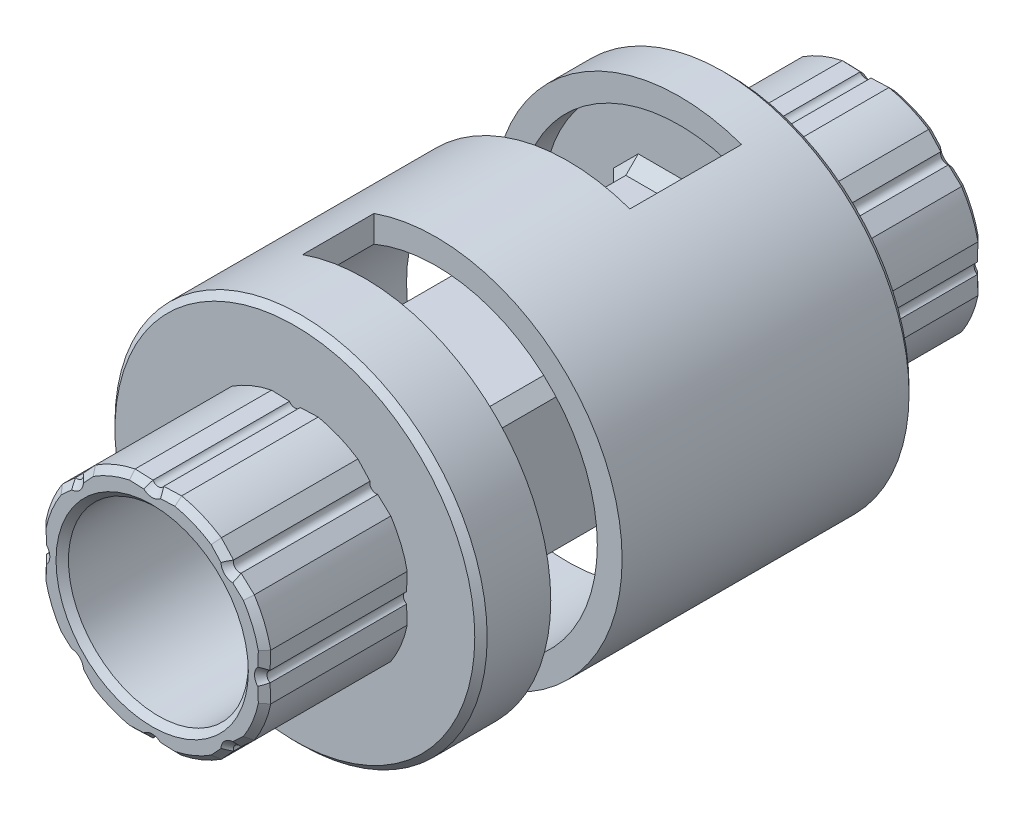
from build123d import *
from OCP.BRepFilletAPI import BRepFilletAPI_MakeChamfer

# Parameters (mm, degrees)
SKETCH1_R               = 30
SKETCH1_R_2             = 26
BOSS_EXTRUDE1_DEPTH     = 70
CUT_EXTRUDE1_DEPTH      = 82.8535277187245
CUT_EXTRUDE1_DEPTH_BACK = 82.8535277187245
SKETCH2_W               = 40
SKETCH2_H               = 17.999999999999996
BOSS_EXTRUDE2_START     = -4
SKETCH4_R               = 30
BOSS_EXTRUDE2_DEPTH     = 4
SKETCH5_R               = 30
BOSS_EXTRUDE3_DEPTH     = 4
SKETCH8_R               = 18.5
SKETCH8_R_2             = 14.499999999999998
BOSS_EXTRUDE4_DEPTH     = 20
BOSS_EXTRUDE5_START     = 20
SKETCH9_R               = 18.5
SKETCH9_R_2             = 14.499999999999998
BOSS_EXTRUDE5_DEPTH     = 20
SKETCH13_R              = 1.0000000000000002
SKETCH13_R_2            = 1.00000000000011
SKETCH13_R_3            = 1.000000000000757
SKETCH13_R_4            = 1.0000000000015887
SKETCH13_R_5            = 1.0000000000021285
SKETCH13_R_6            = 1.0000000000020766
SKETCH13_R_7            = 1.0000000000014964
SKETCH13_R_8            = 1.0000000000007303
CUT_EXTRUDE4_DEPTH      = 20
CUT_EXTRUDE5_START      = -20
SKETCH14_R              = 1.0000000000000007
SKETCH14_R_2            = 1.0000000000000917
SKETCH14_R_3            = 1.000000000000583
SKETCH14_R_4            = 1.000000000001215
SKETCH14_R_5            = 1.0000000000016258
SKETCH14_R_6            = 1.0000000000015943
SKETCH14_R_7            = 1.0000000000011684
SKETCH14_R_8            = 1.0000000000006048
CUT_EXTRUDE5_DEPTH      = 20
CHAMFER1_START          = -21
CHAMFER1_DEPTH          = 21
CHAMFER1_START_2        = 70
CHAMFER1_2_DEPTH        = 21
CUT_EXTRUDE6_DEPTH      = 118.89826122551598
SKETCH16_W              = 25.300000000000004
SKETCH16_H              = 25.3
BOSS_EXTRUDE7_DEPTH     = 62
CHAMFER4_SIZE           = 2
CHAMFER5_SIZE           = 0.5
CHAMFER6_SIZE           = 10
CHAMFER6_SIZE2          = 0.8748866352592419
SKETCH20_R              = 14.499999999999998
BOSS_EXTRUDE9_DEPTH     = 3
BOSS_EXTRUDE10_START    = 3
SKETCH21_R              = 14.499999999999998
BOSS_EXTRUDE10_DEPTH    = 3
CHAMFER14_SIZE          = 1


with BuildPart() as part:
    # Sketch1 → Boss-Extrude1 (new body)
    with BuildSketch(Plane.XY):
        Circle(SKETCH1_R)
        Circle(SKETCH1_R_2, mode=Mode.SUBTRACT)
    extrude(amount=BOSS_EXTRUDE1_DEPTH)

    # Sketch2 → Cut-Extrude1 (cut, two sides: drawn at the far end of the back side and taken through both)
    with BuildSketch(Plane(origin=(0, 0, 0), x_dir=(1, 0, 0), z_dir=(0, 1, 0)).offset(-CUT_EXTRUDE1_DEPTH_BACK)):
        with Locations((-10.000000000000002, -17.000000000000007)):
            Rectangle(SKETCH2_W, SKETCH2_H)
        Polygon((-10.000000000000002, -47.25000000000001), (30, -47.250000000000014), (30, -58.75), (-10.000000000000002, -58.75000000000001), align=None)
    extrude(amount=CUT_EXTRUDE1_DEPTH + CUT_EXTRUDE1_DEPTH_BACK, mode=Mode.SUBTRACT)

    # Sketch4 → Boss-Extrude2 (add)
    with BuildSketch(Plane.XY.offset(70).offset(BOSS_EXTRUDE2_START)):
        Circle(SKETCH4_R)
    extrude(amount=BOSS_EXTRUDE2_DEPTH)

    # Sketch5 → Boss-Extrude3 (add)
    with BuildSketch(Plane(origin=(0, 0, 0), x_dir=(-1, 0, 0), z_dir=(0, 0, -1))):
        with Locations(Location((0, 0, 0), (0, 0, 180))):
            Circle(SKETCH5_R)
    extrude(amount=-BOSS_EXTRUDE3_DEPTH)

    # Sketch8 → Boss-Extrude4 (add)
    with BuildSketch(Plane.XY.offset(70)):
        Circle(SKETCH8_R)
        Circle(SKETCH8_R_2, mode=Mode.SUBTRACT)
    extrude(amount=BOSS_EXTRUDE4_DEPTH)

    # Sketch9 → Boss-Extrude5 (add)
    with BuildSketch(Plane(origin=(0, 0, 0), x_dir=(-1, 0, 0), z_dir=(0, 0, -1)).offset(BOSS_EXTRUDE5_START)):
        with Locations(Location((0, 0, 0), (0, 0, 180))):
            Circle(SKETCH9_R)
        with Locations(Location((0, 0, 0), (0, 0, 180))):
            Circle(SKETCH9_R_2, mode=Mode.SUBTRACT)
    extrude(amount=-BOSS_EXTRUDE5_DEPTH)

    # Sketch13 → Cut-Extrude4 (cut)
    with BuildSketch(Plane.XY.offset(90.00000000000001)):
        with Locations((0, 18.5)):
            Circle(SKETCH13_R)
        with Locations((13.081475451951434, 13.08147545195187)):
            Circle(SKETCH13_R_2)
        with Locations((18.500000000001048, 1.0482e-12)):
            Circle(SKETCH13_R_3)
        with Locations((13.081475451952917, -13.081475451950388)):
            Circle(SKETCH13_R_4)
        with Locations((2.09641e-12, -18.5)):
            Circle(SKETCH13_R_5)
        with Locations((-13.081475451949341, -13.081475451951873)):
            Circle(SKETCH13_R_6)
        with Locations((-18.499999999998952, -1.05047e-12)):
            Circle(SKETCH13_R_7)
        with Locations((-13.081475451950825, 13.081475451950384)):
            Circle(SKETCH13_R_8)
    extrude(amount=-CUT_EXTRUDE4_DEPTH, mode=Mode.SUBTRACT)

    # Sketch14 → Cut-Extrude5 (cut)
    with BuildSketch(Plane(origin=(0, 0, -20), x_dir=(-1, 0, 0), z_dir=(0, 0, -1)).offset(CUT_EXTRUDE5_START)):
        with Locations((0, 18.5)):
            Circle(SKETCH14_R)
        with Locations((13.081475451951356, 13.081475451951684)):
            Circle(SKETCH14_R_2)
        with Locations((18.50000000000078, 7.853e-13)):
            Circle(SKETCH14_R_3)
        with Locations((13.08147545195247, -13.081475451950572)):
            Circle(SKETCH14_R_4)
        with Locations((1.57061e-12, -18.5)):
            Circle(SKETCH14_R_5)
        with Locations((-13.081475451949789, -13.081475451951686)):
            Circle(SKETCH14_R_6)
        with Locations((-18.499999999999215, -7.8757e-13)):
            Circle(SKETCH14_R_7)
        with Locations((-13.081475451950903, 13.081475451950569)):
            Circle(SKETCH14_R_8)
    extrude(amount=CUT_EXTRUDE5_DEPTH, mode=Mode.SUBTRACT)

    # Chamfer1: read off the stored shape, not the designer's step
    # Chamfer1 outline → Chamfer1 (cut)
    with BuildSketch(Plane.XY.offset(CHAMFER1_START)):
        with BuildLine():
            Line((0.866111, 18.000148286), (3.755426238, 18.114821936))
            ThreePointArc((3.755426238, 18.114821936), (2.384264914, 18.345715598), (0.999634703, 18.472972973))
            ThreePointArc((0.999634703, 18.472972973), (0.962363005, 18.228232734), (0.866111, 18.000148286))
        make_face()
        with BuildLine():
            ThreePointArc((12.355515981, 13.769212935), (11.286450017, 14.658309794), (10.153626072, 15.46460079))
            Line((10.153626072, 15.46460079), (12.115593954, 13.340459876))
            ThreePointArc((12.115593954, 13.340459876), (12.208813569, 13.569800382), (12.355515981, 13.769212935))
        make_face()
        with BuildLine():
            Line((-3.755426238, 18.114821936), (-0.866111, 18.000148286))
            ThreePointArc((-0.866111, 18.000148286), (-0.962363005, 18.228232734), (-0.999634703, 18.472972973))
            ThreePointArc((-0.999634703, 18.472972973), (-2.384264914, 18.345715598), (-3.755426238, 18.114821936))
        make_face()
        with BuildLine():
            ThreePointArc((13.769212935, 12.355515981), (13.569800382, 12.208813569), (13.340459876, 12.115593954))
            Line((13.340459876, 12.115593954), (15.46460079, 10.153626072))
            ThreePointArc((15.46460079, 10.153626072), (14.658309794, 11.286450017), (13.769212935, 12.355515981))
        make_face()
        with BuildLine():
            Line((-12.115593954, 13.340459876), (-10.153626072, 15.46460079))
            ThreePointArc((-10.153626072, 15.46460079), (-11.286450017, 14.658309794), (-12.355515981, 13.769212935))
            ThreePointArc((-12.355515981, 13.769212935), (-12.208813569, 13.569800382), (-12.115593954, 13.340459876))
        make_face()
        with BuildLine():
            ThreePointArc((18.472972973, 0.999634703), (18.345715598, 2.384264914), (18.114821936, 3.755426238))
            Line((18.114821936, 3.755426238), (18.000148286, 0.866111))
            ThreePointArc((18.000148286, 0.866111), (18.228232734, 0.962363005), (18.472972973, 0.999634703))
        make_face()
        with BuildLine():
            Line((-15.46460079, 10.153626072), (-13.340459876, 12.115593954))
            ThreePointArc((-13.340459876, 12.115593954), (-13.569800382, 12.208813569), (-13.769212935, 12.355515981))
            ThreePointArc((-13.769212935, 12.355515981), (-14.658309794, 11.286450017), (-15.46460079, 10.153626072))
        make_face()
        with BuildLine():
            ThreePointArc((18.472972973, -0.999634703), (18.228232734, -0.962363005), (18.000148286, -0.866111))
            Line((18.000148286, -0.866111), (18.114821936, -3.755426238))
            ThreePointArc((18.114821936, -3.755426238), (18.345715598, -2.384264914), (18.472972973, -0.999634703))
        make_face()
        with BuildLine():
            Line((-18.000148286, 0.866111), (-18.114821936, 3.755426238))
            ThreePointArc((-18.114821936, 3.755426238), (-18.345715598, 2.384264914), (-18.472972973, 0.999634703))
            ThreePointArc((-18.472972973, 0.999634703), (-18.228232734, 0.962363005), (-18.000148286, 0.866111))
        make_face()
        with BuildLine():
            ThreePointArc((13.769212935, -12.355515981), (14.658309794, -11.286450017), (15.46460079, -10.153626072))
            Line((15.46460079, -10.153626072), (13.340459876, -12.115593954))
            ThreePointArc((13.340459876, -12.115593954), (13.569800382, -12.208813569), (13.769212935, -12.355515981))
        make_face()
        with BuildLine():
            Line((-18.114821936, -3.755426238), (-18.000148286, -0.866111))
            ThreePointArc((-18.000148286, -0.866111), (-18.228232734, -0.962363005), (-18.472972973, -0.999634703))
            ThreePointArc((-18.472972973, -0.999634703), (-18.345715598, -2.384264914), (-18.114821936, -3.755426238))
        make_face()
        with BuildLine():
            ThreePointArc((12.355515981, -13.769212935), (12.208813569, -13.569800382), (12.115593954, -13.340459876))
            Line((12.115593954, -13.340459876), (10.153626072, -15.46460079))
            ThreePointArc((10.153626072, -15.46460079), (11.286450017, -14.658309794), (12.355515981, -13.769212935))
        make_face()
        with BuildLine():
            Line((-13.340459876, -12.115593954), (-15.46460079, -10.153626072))
            ThreePointArc((-15.46460079, -10.153626072), (-14.658309794, -11.286450017), (-13.769212935, -12.355515981))
            ThreePointArc((-13.769212935, -12.355515981), (-13.569800382, -12.208813569), (-13.340459876, -12.115593954))
        make_face()
        with BuildLine():
            ThreePointArc((0.999634703, -18.472972973), (2.384264914, -18.345715598), (3.755426238, -18.114821936))
            Line((3.755426238, -18.114821936), (0.866111, -18.000148286))
            ThreePointArc((0.866111, -18.000148286), (0.962363005, -18.228232734), (0.999634703, -18.472972973))
        make_face()
        with BuildLine():
            Line((-10.153626072, -15.46460079), (-12.115593954, -13.340459876))
            ThreePointArc((-12.115593954, -13.340459876), (-12.208813569, -13.569800382), (-12.355515981, -13.769212935))
            ThreePointArc((-12.355515981, -13.769212935), (-11.286450017, -14.658309794), (-10.153626072, -15.46460079))
        make_face()
        with BuildLine():
            ThreePointArc((-0.999634703, -18.472972973), (-0.962363005, -18.228232734), (-0.866111, -18.000148286))
            Line((-0.866111, -18.000148286), (-3.755426238, -18.114821936))
            ThreePointArc((-3.755426238, -18.114821936), (-2.384264914, -18.345715598), (-0.999634703, -18.472972973))
        make_face()
    extrude(amount=CHAMFER1_DEPTH, mode=Mode.SUBTRACT)

    # Chamfer1 2 outline → Chamfer1 2 (cut)
    with BuildSketch(Plane.XY.offset(CHAMFER1_START_2)):
        with BuildLine():
            Line((0.866111, 18.000148286), (3.755426238, 18.114821936))
            ThreePointArc((3.755426238, 18.114821936), (2.384264914, 18.345715598), (0.999634703, 18.472972973))
            ThreePointArc((0.999634703, 18.472972973), (0.962363005, 18.228232734), (0.866111, 18.000148286))
        make_face()
        with BuildLine():
            ThreePointArc((12.355515981, 13.769212935), (11.286450017, 14.658309794), (10.153626072, 15.46460079))
            Line((10.153626072, 15.46460079), (12.115593954, 13.340459876))
            ThreePointArc((12.115593954, 13.340459876), (12.208813569, 13.569800382), (12.355515981, 13.769212935))
        make_face()
        with BuildLine():
            Line((-3.755426238, 18.114821936), (-0.866111, 18.000148286))
            ThreePointArc((-0.866111, 18.000148286), (-0.962363005, 18.228232734), (-0.999634703, 18.472972973))
            ThreePointArc((-0.999634703, 18.472972973), (-2.384264914, 18.345715598), (-3.755426238, 18.114821936))
        make_face()
        with BuildLine():
            ThreePointArc((13.769212935, 12.355515981), (13.569800382, 12.208813569), (13.340459876, 12.115593954))
            Line((13.340459876, 12.115593954), (15.46460079, 10.153626072))
            ThreePointArc((15.46460079, 10.153626072), (14.658309794, 11.286450017), (13.769212935, 12.355515981))
        make_face()
        with BuildLine():
            Line((-12.115593954, 13.340459876), (-10.153626072, 15.46460079))
            ThreePointArc((-10.153626072, 15.46460079), (-11.286450017, 14.658309794), (-12.355515981, 13.769212935))
            ThreePointArc((-12.355515981, 13.769212935), (-12.208813569, 13.569800382), (-12.115593954, 13.340459876))
        make_face()
        with BuildLine():
            ThreePointArc((18.472972973, 0.999634703), (18.345715598, 2.384264914), (18.114821936, 3.755426238))
            Line((18.114821936, 3.755426238), (18.000148286, 0.866111))
            ThreePointArc((18.000148286, 0.866111), (18.228232734, 0.962363005), (18.472972973, 0.999634703))
        make_face()
        with BuildLine():
            Line((-15.46460079, 10.153626072), (-13.340459876, 12.115593954))
            ThreePointArc((-13.340459876, 12.115593954), (-13.569800382, 12.208813569), (-13.769212935, 12.355515981))
            ThreePointArc((-13.769212935, 12.355515981), (-14.658309794, 11.286450017), (-15.46460079, 10.153626072))
        make_face()
        with BuildLine():
            ThreePointArc((18.472972973, -0.999634703), (18.228232734, -0.962363005), (18.000148286, -0.866111))
            Line((18.000148286, -0.866111), (18.114821936, -3.755426238))
            ThreePointArc((18.114821936, -3.755426238), (18.345715598, -2.384264914), (18.472972973, -0.999634703))
        make_face()
        with BuildLine():
            Line((-18.000148286, 0.866111), (-18.114821936, 3.755426238))
            ThreePointArc((-18.114821936, 3.755426238), (-18.345715598, 2.384264914), (-18.472972973, 0.999634703))
            ThreePointArc((-18.472972973, 0.999634703), (-18.228232734, 0.962363005), (-18.000148286, 0.866111))
        make_face()
        with BuildLine():
            ThreePointArc((13.769212935, -12.355515981), (14.658309794, -11.286450017), (15.46460079, -10.153626072))
            Line((15.46460079, -10.153626072), (13.340459876, -12.115593954))
            ThreePointArc((13.340459876, -12.115593954), (13.569800382, -12.208813569), (13.769212935, -12.355515981))
        make_face()
        with BuildLine():
            Line((-18.114821936, -3.755426238), (-18.000148286, -0.866111))
            ThreePointArc((-18.000148286, -0.866111), (-18.228232734, -0.962363005), (-18.472972973, -0.999634703))
            ThreePointArc((-18.472972973, -0.999634703), (-18.345715598, -2.384264914), (-18.114821936, -3.755426238))
        make_face()
        with BuildLine():
            ThreePointArc((12.355515981, -13.769212935), (12.208813569, -13.569800382), (12.115593954, -13.340459876))
            Line((12.115593954, -13.340459876), (10.153626072, -15.46460079))
            ThreePointArc((10.153626072, -15.46460079), (11.286450017, -14.658309794), (12.355515981, -13.769212935))
        make_face()
        with BuildLine():
            Line((-13.340459876, -12.115593954), (-15.46460079, -10.153626072))
            ThreePointArc((-15.46460079, -10.153626072), (-14.658309794, -11.286450017), (-13.769212935, -12.355515981))
            ThreePointArc((-13.769212935, -12.355515981), (-13.569800382, -12.208813569), (-13.340459876, -12.115593954))
        make_face()
        with BuildLine():
            ThreePointArc((0.999634703, -18.472972973), (2.384264914, -18.345715598), (3.755426238, -18.114821936))
            Line((3.755426238, -18.114821936), (0.866111, -18.000148286))
            ThreePointArc((0.866111, -18.000148286), (0.962363005, -18.228232734), (0.999634703, -18.472972973))
        make_face()
        with BuildLine():
            Line((-10.153626072, -15.46460079), (-12.115593954, -13.340459876))
            ThreePointArc((-12.115593954, -13.340459876), (-12.208813569, -13.569800382), (-12.355515981, -13.769212935))
            ThreePointArc((-12.355515981, -13.769212935), (-11.286450017, -14.658309794), (-10.153626072, -15.46460079))
        make_face()
        with BuildLine():
            ThreePointArc((-0.999634703, -18.472972973), (-0.962363005, -18.228232734), (-0.866111, -18.000148286))
            Line((-0.866111, -18.000148286), (-3.755426238, -18.114821936))
            ThreePointArc((-3.755426238, -18.114821936), (-2.384264914, -18.345715598), (-0.999634703, -18.472972973))
        make_face()
    extrude(amount=CHAMFER1_2_DEPTH, mode=Mode.SUBTRACT)

    # Sketch15 → Cut-Extrude6 (cut, through all)
    with BuildSketch(Plane(origin=(0, 0, -20), x_dir=(-1, 0, 0), z_dir=(0, 0, -1))):
        Polygon((-10.150000000000002, 10.15), (10.149999999999999, 10.15), (10.15, -10.15), (-10.149999999999999, -10.15), align=None)
    extrude(amount=-CUT_EXTRUDE6_DEPTH, mode=Mode.SUBTRACT)

    # Sketch16 → Boss-Extrude7 (add)
    with BuildSketch(Plane.XY.offset(4)):
        Rectangle(SKETCH16_W, SKETCH16_H)
        Polygon((10.149999999999999, -10.15), (-10.15, -10.15), (-10.149999999999999, 10.15), (10.150000000000002, 10.15), align=None, mode=Mode.SUBTRACT)
    extrude(amount=BOSS_EXTRUDE7_DEPTH)

    # Chamfer4
    chamfer4_edges = [part.edges().sort_by_distance(p)[0] for p in [
        (12.650000000000004, 12.650000000000002, 35),
        (0, 12.650000000000002, 4),
        (12.650000000000004, -12.650000000000002, 35),
        (12.650000000000004, 0, 4),
        (-12.650000000000002, -12.650000000000002, 35),
        (1.78e-15, -12.650000000000002, 4),
        (-12.650000000000002, 12.650000000000002, 35),
        (-12.650000000000002, 0, 4),
        (0, 12.650000000000002, 66),
        (-12.650000000000002, 0, 66),
        (1.78e-15, -12.650000000000002, 66),
        (12.650000000000004, 0, 66),
    ]]
    chamfer(chamfer4_edges, length=CHAMFER4_SIZE)

    # Chamfer5
    chamfer5_edges = [part.edges().sort_by_distance(p)[0] for p in [
        (-10.149999999999999, 10.15, 35),
        (-10.15, -10.15, 35),
        (10.149999999999999, -10.15, 35),
        (10.150000000000002, 10.15, 35),
    ]]
    chamfer(chamfer5_edges, length=CHAMFER5_SIZE)

    # Chamfer6: one chamfer whose edges measure the first distance from different faces: ONE call of the kernel's chamfer builder (chamfer() names one face for all edges)
    chamfer6_edges_1 = [part.edges().sort_by_distance(p)[0] for p in [
        (-10.149999999999999, 0, 70),
        (-10.149999999999999, 0, 0),
    ]]
    chamfer6_side_1 = [part.faces().sort_by_distance(p)[0] for p in [
        (-10.149999999999999, -2.2e-16, 35),
    ]]
    chamfer6_edges_2 = [part.edges().sort_by_distance(p)[0] for p in [
        (0, -10.15, 70),
        (0, -10.15, 0),
    ]]
    chamfer6_side_2 = [part.faces().sort_by_distance(p)[0] for p in [
        (-1.94e-15, -10.15, 35),
    ]]
    chamfer6_edges_3 = [part.edges().sort_by_distance(p)[0] for p in [
        (2.66e-15, 10.15, 70),
        (2.66e-15, 10.15, 0),
    ]]
    chamfer6_side_3 = [part.faces().sort_by_distance(p)[0] for p in [
        (1.55e-15, 10.15, 35),
    ]]
    chamfer6_edges_4 = [part.edges().sort_by_distance(p)[0] for p in [
        (10.15, 0, 70),
        (10.15, 0, 0),
    ]]
    chamfer6_side_4 = [part.faces().sort_by_distance(p)[0] for p in [
        (10.15, 2.2e-16, 35),
    ]]
    chamfer6 = BRepFilletAPI_MakeChamfer(part.part.solid().wrapped)
    for e in chamfer6_edges_1:
        chamfer6.Add(CHAMFER6_SIZE, CHAMFER6_SIZE2, e.wrapped, chamfer6_side_1[0].wrapped)  # the first distance lies on this face
    for e in chamfer6_edges_2:
        chamfer6.Add(CHAMFER6_SIZE, CHAMFER6_SIZE2, e.wrapped, chamfer6_side_2[0].wrapped)  # the first distance lies on this face
    for e in chamfer6_edges_3:
        chamfer6.Add(CHAMFER6_SIZE, CHAMFER6_SIZE2, e.wrapped, chamfer6_side_3[0].wrapped)  # the first distance lies on this face
    for e in chamfer6_edges_4:
        chamfer6.Add(CHAMFER6_SIZE, CHAMFER6_SIZE2, e.wrapped, chamfer6_side_4[0].wrapped)  # the first distance lies on this face
    add(Compound.cast(chamfer6.Shape()), mode=Mode.REPLACE)

    # Sketch20 → Boss-Extrude9 (add)
    with BuildSketch(Plane.XY.offset(90.00000000000001)):
        with BuildLine():
            Line((3.755426237801496, 18.11482193598469), (0.8661109996613391, 18.000148285723018))
            ThreePointArc((0.8661109996613391, 18.000148285723018), (-2.16e-15, 17.5), (-0.8661109996613412, 18.00014828572302))
            Line((-0.8661109996613412, 18.00014828572302), (-3.7554262378014793, 18.114821935984693))
            ThreePointArc((-3.7554262378014793, 18.114821935984693), (-7.079643498753856, 17.09177135145893), (-10.15362607192574, 15.46460078991727))
            Line((-10.15362607192574, 15.46460078991727), (-12.115593954076601, 13.340459876319319))
            ThreePointArc((-12.115593954076601, 13.340459876319319), (-12.374368670763749, 12.37436867076333), (-13.340459876319729, 12.115593954076152))
            Line((-13.340459876319729, 12.115593954076152), (-15.464600789917606, 10.153626071925233))
            ThreePointArc((-15.464600789917606, 10.153626071925233), (-17.091771351458892, 7.079643498753959), (-18.11482193598453, 3.7554262378022862))
            Line((-18.11482193598453, 3.7554262378022862), (-18.00014828572247, 0.8661109996623043))
            ThreePointArc((-18.00014828572247, 0.8661109996623043), (-17.499999999997456, -9.9696e-13), (-18.00014828572238, -0.8661109996643512))
            Line((-18.00014828572238, -0.8661109996643512), (-18.114821935984107, -3.7554262378043095))
            ThreePointArc((-18.114821935984107, -3.7554262378043095), (-17.091771351458387, -7.079643498755172), (-15.464600789917297, -10.153626071925704))
            Line((-15.464600789917297, -10.153626071925704), (-13.340459876318839, -12.115593954076408))
            ThreePointArc((-13.340459876318839, -12.115593954076408), (-12.374368670761392, -12.374368670763792), (-12.115593954073828, -13.340459876321189))
            Line((-12.115593954073828, -13.340459876321189), (-10.153626071922737, -15.464600789919244))
            ThreePointArc((-10.153626071922737, -15.464600789919244), (-7.079643498752361, -17.09177135145955), (-3.755426237801829, -18.114821935984622))
            Line((-3.755426237801829, -18.114821935984622), (-0.8661109996612554, -18.000148285722247))
            ThreePointArc((-0.8661109996612554, -18.000148285722247), (1.98945e-12, -17.499999999997872), (0.8661109996653403, -18.000148285722062))
            Line((0.8661109996653403, -18.000148285722062), (3.7554262378059127, -18.114821935983773))
            ThreePointArc((3.7554262378059127, -18.114821935983773), (7.07964349875628, -17.09177135145793), (10.153626071926338, -15.464600789916883))
            Line((10.153626071926338, -15.464600789916883), (12.115593954077465, -13.340459876318048))
            ThreePointArc((12.115593954077465, -13.340459876318048), (12.374368670765179, -12.374368670762783), (13.340459876320395, -12.115593954074885))
            Line((13.340459876320395, -12.115593954074885), (15.464600789918824, -10.153626071923375))
            ThreePointArc((15.464600789918824, -10.153626071923375), (17.09177135145953, -7.079643498752411), (18.114821935984754, -3.7554262378011853))
            Line((18.114821935984754, -3.7554262378011853), (18.000148285722762, -0.8661109996604116))
            ThreePointArc((18.000148285722762, -0.8661109996604116), (17.50000000000029, 9.906e-13), (18.000148285722663, 0.8661109996624502))
            Line((18.000148285722663, 0.8661109996624502), (18.114821935984335, 3.7554262378032))
            ThreePointArc((18.114821935984335, 3.7554262378032), (17.091771351458416, 7.079643498755092), (15.464600789916766, 10.153626071926507))
            Line((15.464600789916766, 10.153626071926507), (13.340459876318482, 12.115593954077784))
            ThreePointArc((13.340459876318482, 12.115593954077784), (12.374368670764817, 12.374368670765234), (12.115593954077339, 13.340459876318892))
            Line((12.115593954077339, 13.340459876318892), (10.15362607192601, 15.464600789917093))
            ThreePointArc((10.15362607192601, 15.464600789917093), (7.079643498754013, 17.091771351458867), (3.755426237801496, 18.11482193598469))
        make_face()
        Circle(SKETCH20_R, mode=Mode.SUBTRACT)
    extrude(amount=BOSS_EXTRUDE9_DEPTH)

    # Sketch21 → Boss-Extrude10 (add)
    with BuildSketch(Plane(origin=(0, 0, -20), x_dir=(-1, 0, 0), z_dir=(0, 0, -1)).offset(BOSS_EXTRUDE10_START)):
        with BuildLine():
            Line((-18.00014828572252, -0.8661109996636396), (-18.114821935984242, -3.7554262378036483))
            ThreePointArc((-18.114821935984242, -3.7554262378036483), (-17.091771351458497, -7.0796434987548995), (-15.464600789917242, -10.153626071925784))
            Line((-15.464600789917242, -10.153626071925784), (-13.34045987631888, -12.11559395407661))
            ThreePointArc((-13.34045987631888, -12.11559395407661), (-12.374368670762163, -12.374368670763962), (-12.115593954074678, -13.340459876320642))
            Line((-12.115593954074678, -13.340459876320642), (-10.15362607192358, -15.464600789918688))
            ThreePointArc((-10.15362607192358, -15.464600789918688), (-7.079643498752809, -17.091771351459364), (-3.7554262378017857, -18.11482193598463))
            Line((-3.7554262378017857, -18.11482193598463), (-0.8661109996613073, -18.00014828572243))
            ThreePointArc((-0.8661109996613073, -18.00014828572243), (1.48851e-12, -17.499999999998373), (0.8661109996643663, -18.00014828572229))
            Line((0.8661109996643663, -18.00014828572229), (3.7554262378048464, -18.114821935983993))
            ThreePointArc((3.7554262378048464, -18.114821935983993), (7.079643498755752, -17.091771351458146), (10.153626071926295, -15.464600789916904))
            Line((10.153626071926295, -15.464600789916904), (12.115593954077417, -13.340459876318285))
            ThreePointArc((12.115593954077417, -13.340459876318285), (12.374368670765014, -12.374368670763216), (13.340459876320047, -12.115593954075484))
            Line((13.340459876320047, -12.115593954075484), (15.464600789918363, -10.153626071924073))
            ThreePointArc((15.464600789918363, -10.153626071924073), (17.091771351459347, -7.079643498752842), (18.114821935984732, -3.755426237801281))
            Line((18.114821935984732, -3.755426237801281), (18.000148285722823, -0.86611099966066))
            ThreePointArc((18.000148285722823, -0.86611099966066), (17.5000000000002, 7.4279e-13), (18.000148285722748, 0.8661109996621887))
            Line((18.000148285722748, 0.8661109996621887), (18.11482193598442, 3.755426237802799))
            ThreePointArc((18.11482193598442, 3.755426237802799), (17.09177135145851, 7.07964349875487), (15.464600789916807, 10.153626071926446))
            Line((15.464600789916807, 10.153626071926446), (13.3404598763186, 12.11559395407767))
            ThreePointArc((13.3404598763186, 12.11559395407767), (12.37436867076475, 12.374368670765064), (12.115593954077335, 13.340459876318912))
            Line((12.115593954077335, 13.340459876318912), (10.15362607192606, 15.464600789917057))
            ThreePointArc((10.15362607192606, 15.464600789917057), (7.079643498754042, 17.09177135145885), (3.7554262378014975, 18.11482193598469))
            Line((3.7554262378014975, 18.11482193598469), (0.8661109996613395, 18.000148285723018))
            ThreePointArc((0.8661109996613395, 18.000148285723018), (-1.94e-15, 17.5), (-0.8661109996613419, 18.00014828572302))
            Line((-0.8661109996613419, 18.00014828572302), (-3.7554262378014815, 18.114821935984693))
            ThreePointArc((-3.7554262378014815, 18.114821935984693), (-7.079643498753909, 17.09177135145891), (-10.153626071925826, 15.464600789917213))
            Line((-10.153626071925826, 15.464600789917213), (-12.11559395407674, 13.340459876319247))
            ThreePointArc((-12.11559395407674, 13.340459876319247), (-12.37436867076392, 12.374368670763603), (-13.340459876319558, 12.115593954076402))
            Line((-13.340459876319558, 12.115593954076402), (-15.464600789917462, 10.153626071925446))
            ThreePointArc((-15.464600789917462, 10.153626071925446), (-17.09177135145887, 7.0796434987540025), (-18.11482193598456, 3.75542623780213))
            Line((-18.11482193598456, 3.75542623780213), (-18.00014828572259, 0.866110999662106))
            ThreePointArc((-18.00014828572259, 0.866110999662106), (-17.499999999998046, -7.4649e-13), (-18.00014828572252, -0.8661109996636396))
        make_face()
        with Locations(Location((0, 0, 0), (0, 0, 180))):
            Circle(SKETCH21_R, mode=Mode.SUBTRACT)
    extrude(amount=-BOSS_EXTRUDE10_DEPTH)

    # Chamfer14
    chamfer14_edges = [part.edges().sort_by_distance(p)[0] for p in [
        (-30, 3.67e-15, 0),
        (-30, 3.67e-15, 70),
        (7.079643498754012, 17.091771351458867, 93.00000000000001),
        (2.3107686187314176, 18.057485110853854, 93.00000000000001),
        (-2.36e-15, 17.5, 93.00000000000001),
        (-2.3107686187314105, 18.057485110853857, 93.00000000000001),
        (-7.079643498753857, 17.09177135145893, 93.00000000000001),
        (-11.13461001300117, 14.402530333118294, 93.00000000000001),
        (-12.374368670763749, 12.37436867076333, 93.00000000000001),
        (-14.402530333118667, 11.134610013000692, 93.00000000000001),
        (-17.09177135145889, 7.079643498753956, 93.00000000000001),
        (-18.057485110853502, 2.310768618732295, 93.00000000000001),
        (-17.499999999997456, -9.9618e-13, 93.00000000000001),
        (-18.057485110853243, -2.3107686187343304, 93.00000000000001),
        (-17.091771351458384, -7.079643498755172, 93.00000000000001),
        (-14.402530333118069, -11.134610013001055, 93.00000000000001),
        (-12.374368670761392, -12.374368670763792, 93.00000000000001),
        (-11.134610012998284, -14.402530333120216, 93.00000000000001),
        (-7.079643498752363, -17.09177135145955, 93.00000000000001),
        (-2.310768618731542, -18.057485110853435, 93.00000000000001),
        (1.98933e-12, -17.499999999997872, 93.00000000000001),
        (2.3107686187356267, -18.057485110852916, 93.00000000000001),
        (7.079643498756278, -17.09177135145793, 93.00000000000001),
        (11.1346100130019, -14.402530333117465, 93.00000000000001),
        (12.374368670765179, -12.374368670762783, 93.00000000000001),
        (14.40253033311961, -11.13461001299913, 93.00000000000001),
        (17.09177135145953, -7.079643498752413, 93.00000000000001),
        (18.057485110853758, -2.3107686187307985, 93.00000000000001),
        (17.50000000000029, 9.9065e-13, 93.00000000000001),
        (18.0574851108535, 2.3107686187328254, 93.00000000000001),
        (17.09177135145842, 7.079643498755091, 93.00000000000001),
        (14.402530333117625, 11.134610013002145, 93.00000000000001),
        (12.374368670764817, 12.374368670765234, 93.00000000000001),
        (11.134610013001675, 14.402530333117992, 93.00000000000001),
        (-14.499999999999998, 1.78e-15, 93.00000000000001),
        (17.499999999998046, -7.4624e-13, -23),
        (18.05748511085338, -2.3107686187336443, -23),
        (17.091771351458494, -7.079643498754904, -23),
        (14.402530333118062, -11.134610013001197, -23),
        (12.374368670762163, -12.374368670763962, -23),
        (11.13461001299913, -14.402530333119664, -23),
        (7.079643498752807, -17.09177135145936, -23),
        (2.3107686187315464, -18.05748511085353, -23),
        (-1.48853e-12, -17.499999999998373, -23),
        (-2.310768618734606, -18.057485110853143, -23),
        (-7.079643498755755, -17.09177135145815, -23),
        (-11.134610013001856, -14.402530333117594, -23),
        (-12.374368670765014, -12.374368670763216, -23),
        (-14.402530333119206, -11.13461001299978, -23),
        (-17.09177135145935, -7.079643498752842, -23),
        (-18.057485110853776, -2.3107686187309704, -23),
        (-17.5000000000002, 7.4266e-13, -23),
        (-18.057485110853584, 2.310768618732494, -23),
        (-17.09177135145851, 7.079643498754869, -23),
        (-14.402530333117703, 11.134610013002058, -23),
        (-12.374368670764747, 12.374368670765065, -23),
        (-11.134610013001698, 14.402530333117983, -23),
        (-7.079643498754043, 17.09177135145885, -23),
        (-2.3107686187314185, 18.057485110853854, -23),
        (2.41e-15, 17.5, -23),
        (2.3107686187314114, 18.057485110853857, -23),
        (7.079643498753905, 17.09177135145891, -23),
        (11.134610013001282, 14.40253033311823, -23),
        (12.37436867076392, 12.374368670763603, -23),
        (14.40253033311851, 11.134610013000923, -23),
        (17.091771351458874, 7.079643498754001, -23),
        (18.057485110853577, 2.310768618732118, -23),
        (-14.499999999999998, -3.55e-15, -23),
    ]]
    chamfer(chamfer14_edges, length=CHAMFER14_SIZE - 0.0001)  # a hair under: the kernel refuses the full size


solid = part.part
